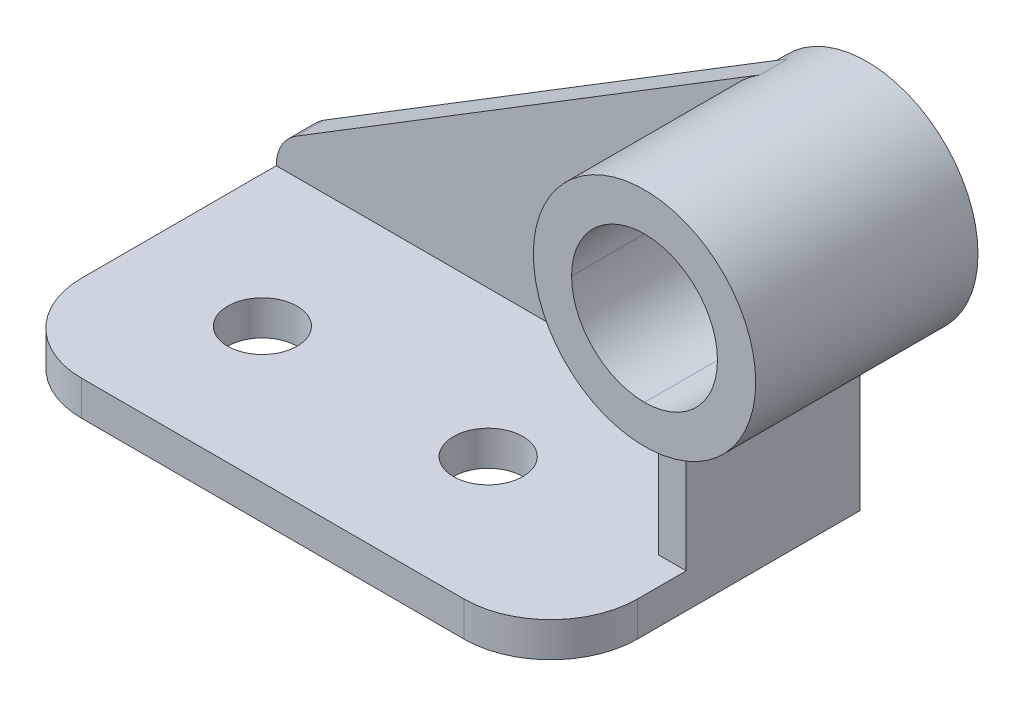
from build123d import *

# Parameters (mm, degrees)
BASE_EXTRUDE_DEPTH  = 10
BOSS_EXTRUDE1_DEPTH = 8
SKETCH3_R           = 32
BOSS_EXTRUDE2_DEPTH = 64
SKETCH7_R           = 21
CUT_EXTRUDE1_DEPTH  = 237.258333186
BOSS_EXTRUDE3_REACH = 233.901
SKETCH4_W           = 8
SKETCH4_H           = 42
HOLE1_D             = 20
LPATTERN1_COUNT     = 2
LPATTERN1_PITCH     = 65


with BuildPart() as part:
    # Sketch1 → Base-Extrude (new body)
    with BuildSketch(Plane(origin=(0, 0, 0), x_dir=(1, 0, 0), z_dir=(0, 1, 0))):
        with BuildLine():
            Line((25, 0), (135, 0))
            ThreePointArc((135, 0), (152.67766953, 7.32233047), (160, 25))
            Line((160, 25), (160, 89))
            Line((160, 89), (0, 89))
            Line((0, 89), (0, 25))
            ThreePointArc((0, 25), (7.32233047, 7.32233047), (25, 0))
        make_face()
    extrude(amount=BASE_EXTRUDE_DEPTH)

    # Sketch2 → Boss-Extrude1 (add)
    with BuildSketch(Plane(origin=(0, 0, -89), x_dir=(-1, 0, 0), z_dir=(0, 0, -1))):
        with BuildLine():
            Line((-160, 10), (0, 10))
            ThreePointArc((0, 10), (-1.526648698, 15.857381028), (-5.718152085, 20.224401536))
            Line((-5.718152085, 20.224401536), (-139.248405559, 102.265070762))
            ThreePointArc((-139.248405559, 102.265070762), (-186.188017348, 85.615253581), (-160, 43.250984267))
            Line((-160, 43.250984267), (-160, 10))
        make_face()
    extrude(amount=-BOSS_EXTRUDE1_DEPTH)

    # Sketch3 → Boss-Extrude2 (add)
    with BuildSketch(Plane(origin=(0, 0, -95), x_dir=(-1, 0, 0), z_dir=(0, 0, -1))):
        with Locations((-156, 75)):
            Circle(SKETCH3_R)
    extrude(amount=-BOSS_EXTRUDE2_DEPTH)

    # Sketch7 → Cut-Extrude1 (cut, through all)
    with BuildSketch(Plane(origin=(0, 0, -95), x_dir=(-1, 0, 0), z_dir=(0, 0, -1))):
        with Locations((-156, 75)):
            Circle(SKETCH7_R)
    extrude(amount=-CUT_EXTRUDE1_DEPTH, mode=Mode.SUBTRACT)

    # Sketch4 → Boss-Extrude3 (add, up to next)
    with BuildSketch(Plane(origin=(0, 10, 0), x_dir=(-1, 0, 0), z_dir=(0, 1, 0)), mode=Mode.PRIVATE) as boss_extrude3_sk1:
        with Locations((-156, -60)):
            Rectangle(SKETCH4_W, SKETCH4_H)
    boss_extrude3_tool1 = extrude(boss_extrude3_sk1.sketch, amount=BOSS_EXTRUDE3_REACH, mode=Mode.PRIVATE) - part.part
    add(boss_extrude3_tool1.solids().sort_by_distance((156, 10, -60))[0])

    # Hole1 (through all)
    with Locations(Plane(origin=(0, 10, 0), x_dir=(-1, 0, 0), z_dir=(0, 1, 0))):
        with Locations((-38, -39)):
            hole1 = Hole(HOLE1_D / 2)

    # LPattern1: Hole1 ×2
    with Locations(*[(i * LPATTERN1_PITCH, 0, 0) for i in range(1, LPATTERN1_COUNT)]):
        add(hole1, mode=Mode.SUBTRACT)


solid = part.part
